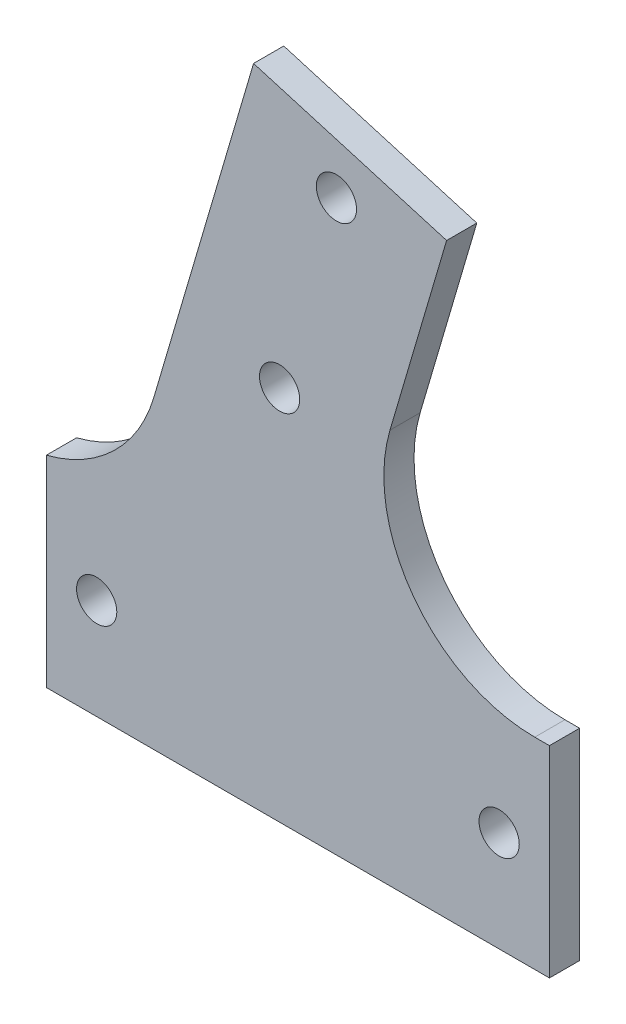
from build123d import *

# Parameters (mm, degrees)
SKETCH_1_W      = 50
SKETCH_1_H      = 20
SKETCH_1_R      = 2
EXTRUDE_1_DEPTH = 3
SKETCH_2_R      = 2
EXTRUDE_2_DEPTH = 3
FILLET_1_R      = 15


with BuildPart() as part:
    # 草图1 → 凸台-拉伸1 (new body)
    with BuildSketch(Plane.XY):
        Rectangle(SKETCH_1_W, SKETCH_1_H)
        with Locations((20, 0)):
            Circle(SKETCH_1_R, mode=Mode.SUBTRACT)
        with Locations((-20, 0)):
            Circle(SKETCH_1_R, mode=Mode.SUBTRACT)
    extrude(amount=EXTRUDE_1_DEPTH)

    # 草图2 → 凸台-拉伸2 (add)
    with BuildSketch(Plane(origin=(0, 0, 0), x_dir=(-1, 0, 0), z_dir=(0, 0, -1))):
        Polygon((-3.494170761, 10), (-14.78082372, 48.374620063), (4.406486311, 54.017946543), (17.352941176, 10), align=None)
        with Locations((-3.826468347, 46.569902088)):
            Circle(SKETCH_2_R, mode=Mode.SUBTRACT)
        with Locations((1.816858133, 27.382592056)):
            Circle(SKETCH_2_R, mode=Mode.SUBTRACT)
    extrude(amount=-EXTRUDE_2_DEPTH)

    # 圆角1
    # the kernel refuses this fillet: 15 mm, written as the material it adds along each edge
    with BuildSketch(Plane(origin=(-17.352941176, 10, 0), x_dir=(-1, 0, 0), z_dir=(0, 0, 1))) as fillet_1_piece_1:
        with BuildLine():
            CenterArc((11.360931708, -14.532967632), FILLET_1_R, 104.335036725, 59.275422941)
            Line((-3.029550815, -10.300472772), (-3.317360466, -10.215822875))
            Line((-3.317360466, -10.215822875), (-0.28780965, 0.084649897))
            Line((-0.28780965, 0.084649897), (0, 0.3))
            ThreePointArc((0, 0.3), (3.823529412, 0.3), (7.572781366, 0.290659353))
            Line((7.572781366, 0.290659353), (7.647058824, 0))
        make_face()
    extrude(amount=3)
    with BuildSketch(Plane(origin=(3.494170761, 10, 0), x_dir=(1, 0, 0), z_dir=(0, 0, 1))) as fillet_1_piece_2:
        with BuildLine():
            CenterArc((FILLET_1_R * 1.33647324392, FILLET_1_R), FILLET_1_R, 163.610459666, 106.389540334)
            Line((FILLET_1_R * 0.37710774235, FILLET_1_R * 1.28216632399), (FILLET_1_R * 0.357920432319, FILLET_1_R * 1.28780965047))
            Line((FILLET_1_R * 0.357920432319, FILLET_1_R * 1.28780965047), (-FILLET_1_R * 0.0267294648784, -FILLET_1_R * 0.02))
            Line((-FILLET_1_R * 0.0267294648784, -FILLET_1_R * 0.02), (FILLET_1_R * 1.33647324392, -FILLET_1_R * 0.02))
            Line((FILLET_1_R * 1.33647324392, -FILLET_1_R * 0.02), (FILLET_1_R * 1.33647324392, 0))
        make_face()
    extrude(amount=3)


solid = part.part
